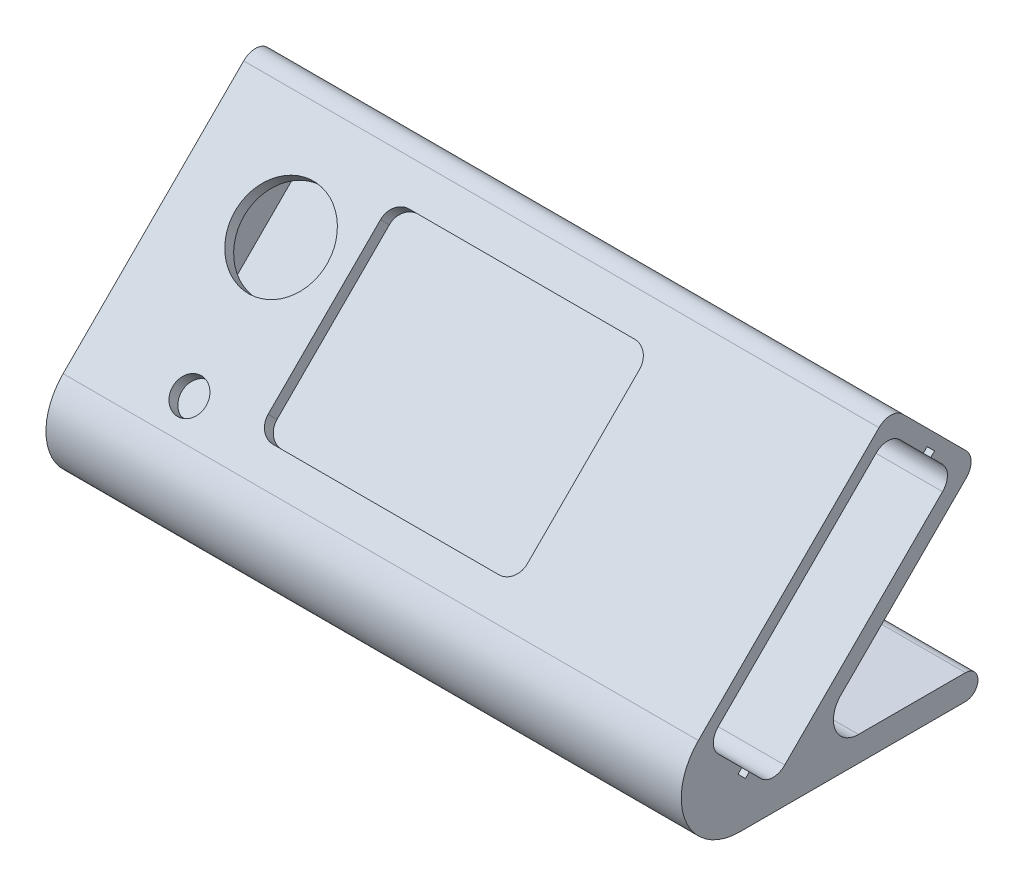
from build123d import *

# Parameters (mm, degrees)
BOSS_EXTRUDE1_DEPTH = 74.5
FILLET1_R           = 7
FILLET2_R           = 2
FILLET3_R           = 1.5
FILLET4_R           = 3
SKETCH3_R           = 5.5
SKETCH3_R_2         = 2
SKETCH3_W           = 31
SKETCH3_H           = 23
CUT_EXTRUDE1_DEPTH  = 1.5
FILLET5_R           = 2
BOSS_EXTRUDE3_DEPTH = 1.5


with BuildPart() as part:
    # Sketch1 → Boss-Extrude1 (new body)
    with BuildSketch(Plane(origin=(0, 0, 0), x_dir=(0, 0, -1), z_dir=(1, 0, 0))):
        Polygon((-20.859650045, -2.828427125), (0, -2.828427125), (24.536605307, -2.828427125), (24.536605307, 0.171572875), (3, 0.171572875), (24.536605307, 21.708178182), (14.106780285, 32.138003205), (-10.429825023, 7.601397898), align=None)
        Polygon((19.339370465, 24.996224715), (18.879751058, 24.536605307), (21.708178182, 21.708178182), (0, 0), (-2.828427125, 2.828427125), (-3.288046533, 2.368807717), (-4.171930009, 3.252691193), (-3.712310601, 3.712310601), (-7.954951288, 7.954951288), (13.753226894, 29.663129471), (17.995867581, 25.420488784), (18.455486989, 25.880108191), align=None, mode=Mode.SUBTRACT)
    extrude(amount=BOSS_EXTRUDE1_DEPTH)

    # Fillet1
    fillet1_edges = [part.edges().sort_by_distance(p)[0] for p in [
        (37.25, -2.828427125, 20.859650045),
    ]]
    fillet(fillet1_edges, radius=FILLET1_R)

    # Fillet2
    fillet2_edges = [part.edges().sort_by_distance(p)[0] for p in [
        (37.25, 32.138003205, -14.106780285),
        (37.25, 21.708178182, -24.536605307),
        (37.25, 29.663129471, -13.753226894),
        (37.25, 7.954951288, 7.954951288),
        (37.25, 0, 0),
        (37.25, 21.708178182, -21.708178182),
    ]]
    fillet(fillet2_edges, radius=FILLET2_R)

    # Fillet3
    fillet3_edges = [part.edges().sort_by_distance(p)[0] for p in [
        (37.25, -2.828427125, -24.536605307),
        (37.25, 0.171572875, -24.536605307),
    ]]
    fillet(fillet3_edges, radius=FILLET3_R - 0.0001)  # a hair under: the kernel refuses the full size

    # Fillet4
    fillet4_edges = [part.edges().sort_by_distance(p)[0] for p in [
        (37.25, 0.171572875, -3),
    ]]
    fillet(fillet4_edges, radius=FILLET4_R)

    # Sketch3 → Cut-Extrude1 (cut)
    with BuildSketch(Plane(origin=(0, 9.01561146, 9.01561146), x_dir=(1, 0, 0), z_dir=(0, 0.7071067811865475, 0.7071067811865476))):
        with Locations(Location((11, 19.35, 0), (0, 0, 270))):
            Circle(SKETCH3_R)
        with Locations(Location((11, 3.85, 0), (0, 0, 270))):
            Circle(SKETCH3_R_2)
        with Locations((34.5, 15.35)):
            Rectangle(SKETCH3_W, SKETCH3_H)
    extrude(amount=-CUT_EXTRUDE1_DEPTH, mode=Mode.SUBTRACT)

    # Fillet5
    fillet5_edges = [part.edges().sort_by_distance(p)[0] for p in [
        (19, 11.207642482, 5.762920267),
        (19, 27.471098449, -10.500535701),
        (50, 27.471098449, -10.500535701),
        (50, 11.207642482, 5.762920267),
    ]]
    fillet(fillet5_edges, radius=FILLET5_R)

    # Sketch4 → Boss-Extrude3 (add)
    with BuildSketch(Plane.ZY):
        with BuildLine():
            Line((-23.036605307, -2.828427125), (3.960155108, -2.828427125))
            ThreePointArc((3.960155108, -2.828427125), (10.427311836, 1.492788849), (8.909902577, 9.121320344))
            Line((8.909902577, 9.121320344), (-12.692566722, 30.723789643))
            ThreePointArc((-12.692566722, 30.723789643), (-14.106780285, 31.30957608), (-15.520993847, 30.723789643))
            Line((-15.520993847, 30.723789643), (-23.122391745, 23.122391745))
            ThreePointArc((-23.122391745, 23.122391745), (-23.708178182, 21.708178182), (-23.122391745, 20.29396462))
            Line((-23.122391745, 20.29396462), (-8.121320344, 5.292893219))
            ThreePointArc((-8.121320344, 5.292893219), (-7.47100209, 2.023522578), (-10.242640687, 0.171572875))
            Line((-10.242640687, 0.171572875), (-23.036605307, 0.171572875))
            ThreePointArc((-23.036605307, 0.171572875), (-24.097265479, -0.267766953), (-24.536605307, -1.328427125))
            ThreePointArc((-24.536605307, -1.328427125), (-24.097265479, -2.389087297), (-23.036605307, -2.828427125))
        make_face()
    extrude(amount=BOSS_EXTRUDE3_DEPTH)


solid = part.part
